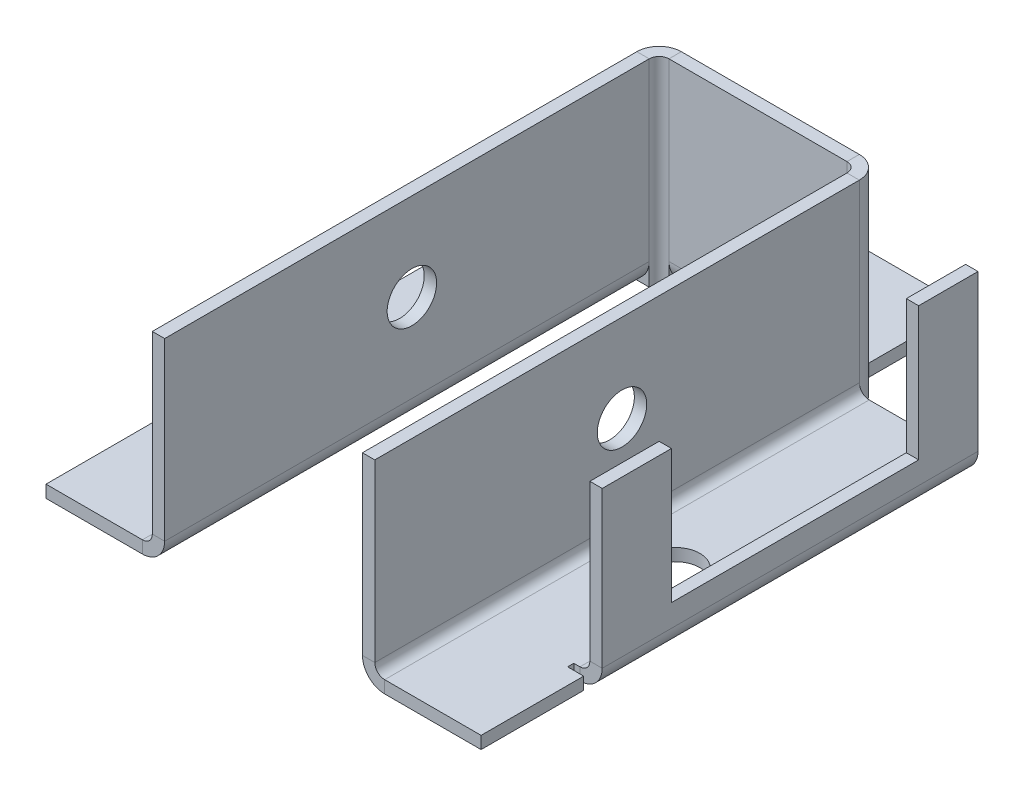
from build123d import *

# Parameters (mm, degrees)
BASE_FLANGE1_DEPTH             = 20
EDGE_FLANGE1_STRIP_W           = 7
EDGE_FLANGE1_STRIP_H           = 1.25
EDGE_FLANGE1_STRIP_CUT_DEPTH   = 49
EDGE_FLANGE1_STRIP_2_W         = 7
EDGE_FLANGE1_STRIP_2_H         = 1.25
EDGE_FLANGE1_STRIP_CUT_2_DEPTH = 18
EDGE_FLANGE1_STRIP_3_W         = 7
EDGE_FLANGE1_STRIP_3_H         = 1.25
EDGE_FLANGE1_STRIP_CUT_3_DEPTH = 49
EDGE_FLANGE1_DEPTH             = 49
EDGE_FLANGE1_BEND_DEPTH        = 18
EDGE_FLANGE1_BEND_2_DEPTH      = 49
CUT_EXTRUDE1_DEPTH             = 47.952768821
CUT_EXTRUDE1_DEPTH_BACK        = 47.952768821
SKETCH15_R                     = 2.5
CUT_EXTRUDE2_DEPTH             = 54.61494661
CUT_EXTRUDE2_DEPTH_BACK        = 54.61494661
SKETCH16_R                     = 2.5
EDGE_FLANGE2_STRIP_W           = 7
EDGE_FLANGE2_STRIP_H           = 1.25
EDGE_FLANGE2_STRIP_CUT_DEPTH   = 38
EDGE_FLANGE2_RELIEF_W          = 7.625
EDGE_FLANGE2_RELIEF_H          = 0.625
EDGE_FLANGE2_RELIEF_CUT_DEPTH  = 1.25
EDGE_FLANGE2_DEPTH             = 38
CUT_EXTRUDE3_DEPTH             = 62.778333581
CUT_EXTRUDE3_DEPTH_BACK        = 1.25
SKETCH20_W                     = 25
SKETCH20_H                     = 13.5


# Sheet-metal steps are written as plain solids
with BuildPart() as part:
    # Sketch1 → Base-Flange1 (new body)
    with BuildSketch(Plane(origin=(0, 0, 0), x_dir=(1, 0, 0), z_dir=(0, 1, 0))):
        with BuildLine():
            Line((-10, -25), (-10, 24))
            ThreePointArc((-10, 24), (-9.707106781, 24.707106781), (-9, 25))
            Line((-9, 25), (9, 25))
            ThreePointArc((9, 25), (9.707106781, 24.707106781), (10, 24))
            Line((10, 24), (10, -25))
            Line((10, -25), (11.25, -25))
            Line((11.25, -25), (11.25, 24))
            ThreePointArc((11.25, 24), (10.590990258, 25.590990258), (9, 26.25))
            Line((9, 26.25), (-9, 26.25))
            ThreePointArc((-9, 26.25), (-10.590990258, 25.590990258), (-11.25, 24))
            Line((-11.25, 24), (-11.25, -25))
            Line((-11.25, -25), (-10, -25))
        make_face()
    extrude(amount=BASE_FLANGE1_DEPTH)

    # Edge-Flange1 strip (across the edge) → Edge-Flange1 strip cut (cut)
    with BuildSketch(Plane(origin=(-11.25, 0, -24), x_dir=(0, 1, 0), z_dir=(0, 0, 1))):
        with Locations((-1.25, -0.625)):
            Rectangle(EDGE_FLANGE1_STRIP_W, EDGE_FLANGE1_STRIP_H)
    extrude(amount=EDGE_FLANGE1_STRIP_CUT_DEPTH, mode=Mode.SUBTRACT)

    # Edge-Flange1 strip 2 (across the edge) → Edge-Flange1 strip cut 2 (cut)
    with BuildSketch(Plane(origin=(9, 0, -26.25), x_dir=(0, 1, 0), z_dir=(-1, 0, 0))):
        with Locations((-1.25, -0.625)):
            Rectangle(EDGE_FLANGE1_STRIP_2_W, EDGE_FLANGE1_STRIP_2_H)
    extrude(amount=EDGE_FLANGE1_STRIP_CUT_2_DEPTH, mode=Mode.SUBTRACT)

    # Edge-Flange1 strip 3 (across the edge) → Edge-Flange1 strip cut 3 (cut)
    with BuildSketch(Plane(origin=(11.25, 0, 25), x_dir=(0, 1, 0), z_dir=(0, 0, -1))):
        with Locations((-1.25, -0.625)):
            Rectangle(EDGE_FLANGE1_STRIP_3_W, EDGE_FLANGE1_STRIP_3_H)
    extrude(amount=EDGE_FLANGE1_STRIP_CUT_3_DEPTH, mode=Mode.SUBTRACT)

    # Edge-Flange1 section (across the edge) → Edge-Flange1 (add)
    with BuildSketch(Plane(origin=(-11.25, 0, -24), x_dir=(0, 1, 0), z_dir=(0, 0, 1))):
        with BuildLine():
            Line((0, 1), (0, 10.75))
            Line((0, 10.75), (1.25, 10.75))
            Line((1.25, 10.75), (1.25, 1))
            ThreePointArc((1.25, 1), (1.542893219, 0.292893219), (2.25, 0))
            Line((2.25, 0), (2.25, -1.25))
            ThreePointArc((2.25, -1.25), (0.659009742, -0.590990258), (0, 1))
        make_face()
    extrude(amount=EDGE_FLANGE1_DEPTH)

    # Edge-Flange1 section 2 (across the edge) → Edge-Flange1 bend (add)
    with BuildSketch(Plane(origin=(9, 0, -26.25), x_dir=(0, 1, 0), z_dir=(-1, 0, 0))):
        with BuildLine():
            Line((0, 1), (0, 10.75))
            Line((0, 10.75), (1.25, 10.75))
            Line((1.25, 10.75), (1.25, 1))
            ThreePointArc((1.25, 1), (1.542893219, 0.292893219), (2.25, 0))
            Line((2.25, 0), (2.25, -1.25))
            ThreePointArc((2.25, -1.25), (0.659009742, -0.590990258), (0, 1))
        make_face()
    extrude(amount=EDGE_FLANGE1_BEND_DEPTH)

    # Edge-Flange1 section 3 (across the edge) → Edge-Flange1 bend 2 (add)
    with BuildSketch(Plane(origin=(11.25, 0, 25), x_dir=(0, 1, 0), z_dir=(0, 0, -1))):
        with BuildLine():
            Line((0, 1), (0, 10.75))
            Line((0, 10.75), (1.25, 10.75))
            Line((1.25, 10.75), (1.25, 1))
            ThreePointArc((1.25, 1), (1.542893219, 0.292893219), (2.25, 0))
            Line((2.25, 0), (2.25, -1.25))
            ThreePointArc((2.25, -1.25), (0.659009742, -0.590990258), (0, 1))
        make_face()
    extrude(amount=EDGE_FLANGE1_BEND_2_DEPTH)

    # Sketch15 → Cut-Extrude1 (cut, two sides: drawn at the far end of the back side and taken through both)
    with BuildSketch(Plane(origin=(0, 1.25, 0), x_dir=(1, 0, 0), z_dir=(0, 1, 0)).offset(-CUT_EXTRUDE1_DEPTH_BACK)):
        with Locations(Location((17.125, -0.5, 0), (0, 0, 180))):
            Circle(SKETCH15_R)
        with Locations(Location((0, 32.125, 0), (0, 0, 180))):
            Circle(SKETCH15_R)
        with Locations(Location((-17.125, -0.5, 0), (0, 0, 180))):
            Circle(SKETCH15_R)
    extrude(amount=CUT_EXTRUDE1_DEPTH + CUT_EXTRUDE1_DEPTH_BACK, mode=Mode.SUBTRACT)

    # Sketch16 → Cut-Extrude2 (cut, two sides: drawn at the far end of the back side and taken through both)
    with BuildSketch(Plane(origin=(11.25, 0, 0), x_dir=(0, 0, -1), z_dir=(1, 0, 0)).offset(-CUT_EXTRUDE2_DEPTH_BACK)):
        with Locations((0, 11.125)):
            Circle(SKETCH16_R)
    extrude(amount=CUT_EXTRUDE2_DEPTH + CUT_EXTRUDE2_DEPTH_BACK, mode=Mode.SUBTRACT)

    # Edge-Flange2 strip (across the edge) → Edge-Flange2 strip cut (cut)
    with BuildSketch(Plane(origin=(22, 1.25, 14), x_dir=(-1, 0, 0), z_dir=(0, 0, -1))):
        with Locations((-2.5, -0.625)):
            Rectangle(EDGE_FLANGE2_STRIP_W, EDGE_FLANGE2_STRIP_H)
    extrude(amount=EDGE_FLANGE2_STRIP_CUT_DEPTH, mode=Mode.SUBTRACT)

    # Edge-Flange2 relief (on the sheet) → Edge-Flange2 relief cut (cut)
    with BuildSketch(Plane(origin=(21, 1.25, 14), x_dir=(-1, 0, 0), z_dir=(0, 1, 0))):
        with Locations((-3.1875, 0.3125)):
            Rectangle(EDGE_FLANGE2_RELIEF_W, EDGE_FLANGE2_RELIEF_H)
    extrude(amount=-EDGE_FLANGE2_RELIEF_CUT_DEPTH, mode=Mode.SUBTRACT)

    # Edge-Flange2 section (across the edge) → Edge-Flange2 (add)
    with BuildSketch(Plane(origin=(22, 1.25, 14), x_dir=(-1, 0, 0), z_dir=(0, 0, -1))):
        with BuildLine():
            Line((-1.25, 1), (-1.25, 16.75))
            Line((-1.25, 16.75), (0, 16.75))
            Line((0, 16.75), (0, 1))
            ThreePointArc((0, 1), (0.292893219, 0.292893219), (1, 0))
            Line((1, 0), (1, -1.25))
            ThreePointArc((1, -1.25), (-0.590990258, -0.590990258), (-1.25, 1))
        make_face()
    extrude(amount=EDGE_FLANGE2_DEPTH)

    # Sketch20 → Cut-Extrude3 (cut, two sides: drawn at the far end of the back side and taken through both)
    with BuildSketch(Plane(origin=(23.25, 0, 0), x_dir=(0, 0, -1), z_dir=(1, 0, 0)).offset(-CUT_EXTRUDE3_DEPTH_BACK)):
        with Locations((5.5, 11.25)):
            Rectangle(SKETCH20_W, SKETCH20_H)
    extrude(amount=CUT_EXTRUDE3_DEPTH + CUT_EXTRUDE3_DEPTH_BACK, mode=Mode.SUBTRACT)


solid = part.part
